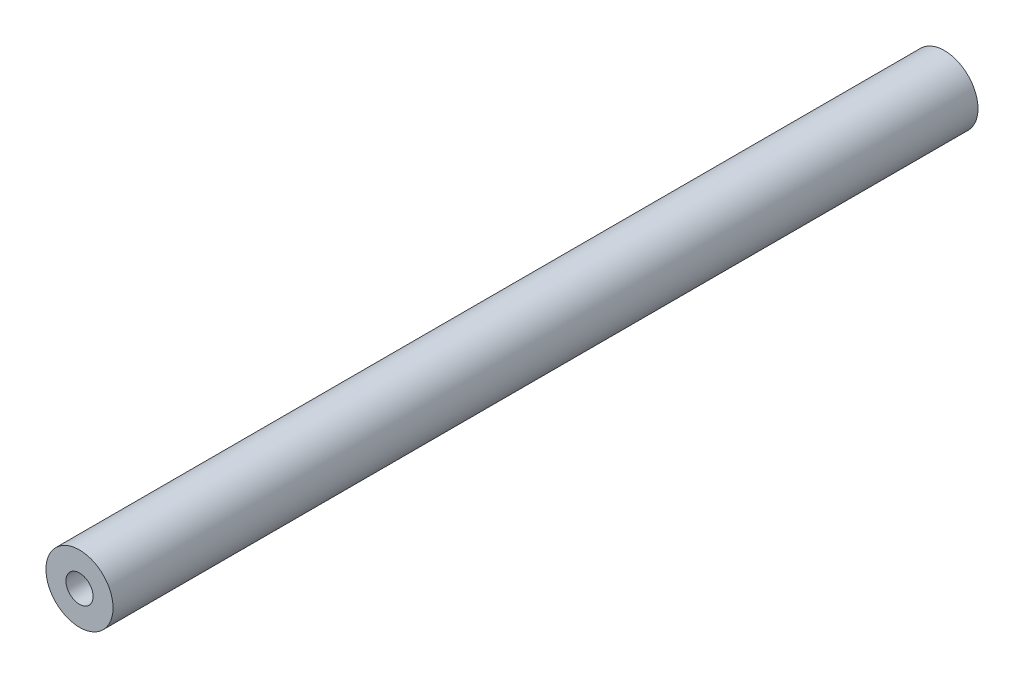
from build123d import *

# Parameters (mm, degrees)
SKETCH1_R                      = 6.4
BOSS_EXTRUDE1_DEPTH            = 165
F_6_0_204_DIAMETER_HOLE1_D     = 5.1816
F_6_0_204_DIAMETER_HOLE1_DEPTH = 30
F_6_0_204_DIAMETER_HOLE1_TIP   = 1.556709692
F_6_0_204_DIAMETER_HOLE2_D     = 5.1816
F_6_0_204_DIAMETER_HOLE2_DEPTH = 30
F_6_0_204_DIAMETER_HOLE2_TIP   = 1.556709692


with BuildPart() as part:
    # Sketch1 → Boss-Extrude1 (new body)
    with BuildSketch(Plane.XY):
        Circle(SKETCH1_R)
    extrude(amount=BOSS_EXTRUDE1_DEPTH)

    # #6 (0.204) Diameter Hole1
    with Locations(Plane(origin=(0, 0, 0), x_dir=(-1, 0, 0), z_dir=(0, 0, -1))):
        with Locations((0, 0)):
            Hole(F_6_0_204_DIAMETER_HOLE1_D / 2, depth=F_6_0_204_DIAMETER_HOLE1_DEPTH)
            with Locations((0, 0, -(F_6_0_204_DIAMETER_HOLE1_DEPTH + F_6_0_204_DIAMETER_HOLE1_TIP / 2))):  # 118° drill point
                Cone(0, F_6_0_204_DIAMETER_HOLE1_D / 2, F_6_0_204_DIAMETER_HOLE1_TIP, mode=Mode.SUBTRACT)

    # #6 (0.204) Diameter Hole2
    with Locations(Plane.XY.offset(165)):
        with Locations((0, 0)):
            Hole(F_6_0_204_DIAMETER_HOLE2_D / 2, depth=F_6_0_204_DIAMETER_HOLE2_DEPTH)
            with Locations((0, 0, -(F_6_0_204_DIAMETER_HOLE2_DEPTH + F_6_0_204_DIAMETER_HOLE2_TIP / 2))):  # 118° drill point
                Cone(0, F_6_0_204_DIAMETER_HOLE2_D / 2, F_6_0_204_DIAMETER_HOLE2_TIP, mode=Mode.SUBTRACT)


solid = part.part
